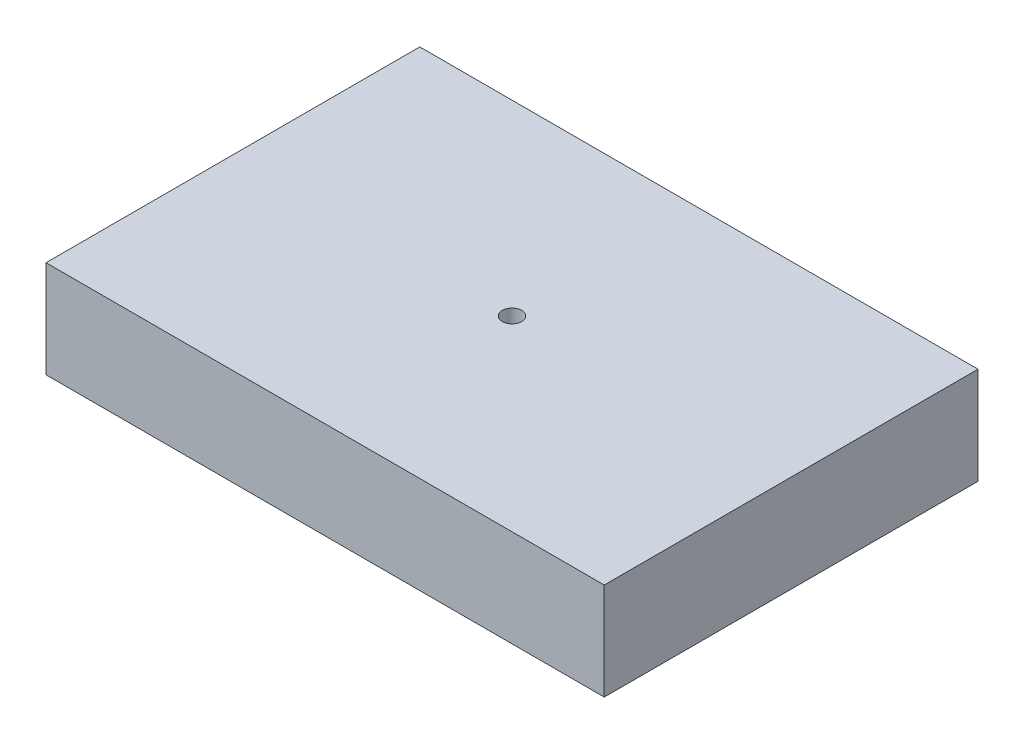
from build123d import *

# Parameters (mm, degrees)
SKETCH1_W             = 575
SKETCH1_H             = 385
BOSS_EXTRUDE1_DEPTH   = 50
CAVITY2_START         = -50
CAVITY2_OUTLINE_R     = 10
CAVITY2_DEPTH         = 100
CAVITY2_2_OUTLINE_R   = 15.25
CAVITY2_2_OUTLINE_R_2 = 10.25
CAVITY2_2_DEPTH       = 20


# Read off the part's stored shape, not the designer's step: Cavity2
with BuildPart() as part:
    # Sketch1 → Boss-Extrude1 (new, symmetric)
    with BuildSketch(Plane(origin=(0, 0, 0), x_dir=(1, 0, 0), z_dir=(0, 1, 0))):
        Rectangle(SKETCH1_W, SKETCH1_H)
    extrude(amount=BOSS_EXTRUDE1_DEPTH, both=True)

    # Cavity2 outline → Cavity2 (cut)
    with BuildSketch(Plane(origin=(0, 0, 0), x_dir=(1, 0, 0), z_dir=(0, 1, 0)).offset(CAVITY2_START)):
        Circle(CAVITY2_OUTLINE_R)
    extrude(amount=CAVITY2_DEPTH, mode=Mode.SUBTRACT)

    # Cavity2 2 outline → Cavity2 2 (cut)
    with BuildSketch(Plane(origin=(0, 0, 0), x_dir=(1, 0, 0), z_dir=(0, 1, 0)).offset(CAVITY2_START)):
        Circle(CAVITY2_2_OUTLINE_R)
        Circle(CAVITY2_2_OUTLINE_R_2, mode=Mode.SUBTRACT)
    extrude(amount=CAVITY2_2_DEPTH, mode=Mode.SUBTRACT)


solid = part.part
